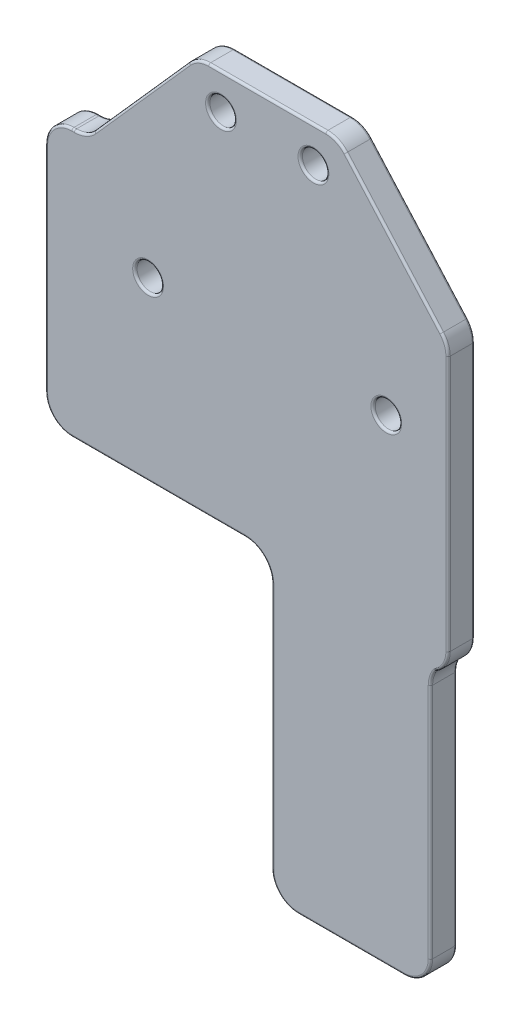
from build123d import *

# Parameters (mm, degrees)
SKETCH1_R           = 1.5
BOSS_EXTRUDE1_DEPTH = 3
FILLET1_R           = 3
FILLET2_R           = 0.25


with BuildPart() as part:
    # Sketch1 → Boss-Extrude1 (new body)
    with BuildSketch(Plane.XY):
        Polygon((-20.5, 47.899715907), (-7.989824602, 62), (7.989824602, 62), (20.5, 47.899715907), (20.5, 15.219549054), (19.070234775, 15.219549054), (18.5, 14.713620449), (18.5, -16.400284093), (0.5, -16.400284093), (0.5, 17.599715907), (-20.5, 17.599715907), (-25.136576575, 17.599715907), (-25.136576575, 47.899715907), align=None)
        with Locations((-5.239824602, 58)):
            Circle(SKETCH1_R, mode=Mode.SUBTRACT)
        with Locations((-13.5, 37.599715907)):
            Circle(SKETCH1_R, mode=Mode.SUBTRACT)
        with Locations(Location((13.5, 37.599715907, 0), (0, 0, 180))):
            Circle(SKETCH1_R, mode=Mode.SUBTRACT)
        with Locations(Location((5.239824602, 58, 0), (0, 0, 180))):
            Circle(SKETCH1_R, mode=Mode.SUBTRACT)
    extrude(amount=BOSS_EXTRUDE1_DEPTH)

    # Fillet1
    # the kernel refuses this fillet: 3 mm, written as the material it adds along each edge
    with BuildSketch(Plane(origin=(0.5, 17.599715907, 0), x_dir=(-1, 0, 0), z_dir=(0, 0, 1))) as fillet1_piece_1:
        with BuildLine():
            CenterArc((FILLET1_R, FILLET1_R), FILLET1_R, 180, 90)
            Line((0, FILLET1_R), (-FILLET1_R * 0.02, FILLET1_R))
            Line((-FILLET1_R * 0.02, FILLET1_R), (-FILLET1_R * 0.02, -FILLET1_R * 0.02))
            Line((-FILLET1_R * 0.02, -FILLET1_R * 0.02), (FILLET1_R, -FILLET1_R * 0.02))
            Line((FILLET1_R, -FILLET1_R * 0.02), (FILLET1_R, 0))
        make_face()
    extrude(amount=3)
    with BuildSketch(Plane(origin=(-20.5, 47.899715907, 0), x_dir=(0.6636697823920836, 0.7480256813369742, 0), z_dir=(0, 0, 1))) as fillet1_piece_2:
        with BuildLine():
            CenterArc((FILLET1_R * 0.449623891264, FILLET1_R), FILLET1_R, 221.580355478, 48.419644522)
            Line((-FILLET1_R * 0.298401790073, FILLET1_R * 0.336330217608), (-FILLET1_R * 0.3133623037, FILLET1_R * 0.32305682196))
            Line((-FILLET1_R * 0.3133623037, FILLET1_R * 0.32305682196), (-FILLET1_R * 0.00899247782528, -FILLET1_R * 0.02))
            Line((-FILLET1_R * 0.00899247782528, -FILLET1_R * 0.02), (FILLET1_R * 0.449623891264, -FILLET1_R * 0.02))
            Line((FILLET1_R * 0.449623891264, -FILLET1_R * 0.02), (FILLET1_R * 0.449623891264, 0))
        make_face()
    extrude(amount=3)
    with BuildSketch(Plane(origin=(18.5, 14.713620449, 0), x_dir=(0, -1, 0), z_dir=(0, 0, 1))) as fillet1_piece_3:
        with BuildLine():
            CenterArc((1.25368526, 3), FILLET1_R, 234.088286061, 35.911713939)
            Line((-0.505928605, 0.570234775), (-0.541120882, 0.521639471))
            ThreePointArc((-0.541120882, 0.521639471), (-0.297845843, 0.245297201), (-0.044881541, -0.039820187))
            Line((-0.044881541, -0.039820187), (0, -0.06))
            Line((0, -0.06), (1.25368526, -0.06))
            Line((1.25368526, -0.06), (1.25368526, 0))
        make_face()
    extrude(amount=3)
    # the kernel refuses this fillet: 3 mm, written as the material it takes off along each edge
    with BuildSketch(Plane(origin=(-7.989824602, 62, -3.372179184), x_dir=(1, 0, 0), z_dir=(0, 0, 1)), Plane(origin=(7.989824602, 62, -3.372179184), x_dir=(0.6636697823920855, -0.7480256813369726, 0), z_dir=(0, 0, 1))) as fillet1_2_piece_1:
        with BuildLine():
            CenterArc((FILLET1_R * 0.449623891264, -FILLET1_R), FILLET1_R, 90, 48.419644522)
            Line((-FILLET1_R * 0.298401790073, -FILLET1_R * 0.336330217608), (-FILLET1_R * 0.3133623037, -FILLET1_R * 0.32305682196))
            Line((-FILLET1_R * 0.3133623037, -FILLET1_R * 0.32305682196), (-FILLET1_R * 0.00899247782527, FILLET1_R * 0.02))
            Line((-FILLET1_R * 0.00899247782527, FILLET1_R * 0.02), (FILLET1_R * 0.449623891264, FILLET1_R * 0.02))
            Line((FILLET1_R * 0.449623891264, FILLET1_R * 0.02), (FILLET1_R * 0.449623891264, 0))
        make_face()
    extrude(amount=9.744358369, mode=Mode.SUBTRACT)
    with BuildSketch(Plane(origin=(18.5, -16.400284093, -7.5), x_dir=(-1, 0, 0), z_dir=(0, 0, 1)), Plane(origin=(0.5, -16.400284093, -7.5), x_dir=(0, 1, 0), z_dir=(0, 0, 1)), Plane(origin=(-25.136576575, 17.599715907, -7.5), x_dir=(0, 1, 0), z_dir=(0, 0, 1)), Plane(origin=(-25.136576575, 47.899715907, -7.5), x_dir=(1, 0, 0), z_dir=(0, 0, 1))) as fillet1_2_piece_2:
        with BuildLine():
            CenterArc((FILLET1_R, -FILLET1_R), FILLET1_R, 90, 90)
            Line((0, -FILLET1_R), (-FILLET1_R * 0.02, -FILLET1_R))
            Line((-FILLET1_R * 0.02, -FILLET1_R), (-FILLET1_R * 0.02, FILLET1_R * 0.02))
            Line((-FILLET1_R * 0.02, FILLET1_R * 0.02), (FILLET1_R, FILLET1_R * 0.02))
            Line((FILLET1_R, FILLET1_R * 0.02), (FILLET1_R, 0))
        make_face()
    extrude(amount=18, mode=Mode.SUBTRACT)
    with BuildSketch(Plane(origin=(20.5, 47.899715907, -2.847511579), x_dir=(0, -1, 0), z_dir=(0, 0, 1))) as fillet1_2_piece_3:
        with BuildLine():
            CenterArc((FILLET1_R * 0.379668210529, -FILLET1_R), FILLET1_R, 90, 41.580355478)
            Line((-FILLET1_R * 0.284001571863, -FILLET1_R * 0.251974318663), (-FILLET1_R * 0.297274967511, -FILLET1_R * 0.237013805036))
            Line((-FILLET1_R * 0.297274967511, -FILLET1_R * 0.237013805036), (-FILLET1_R * 0.00759336421058, FILLET1_R * 0.02))
            Line((-FILLET1_R * 0.00759336421058, FILLET1_R * 0.02), (FILLET1_R * 0.379668210529, FILLET1_R * 0.02))
            Line((FILLET1_R * 0.379668210529, FILLET1_R * 0.02), (FILLET1_R * 0.379668210529, 0))
        make_face()
    extrude(amount=8.695023158, mode=Mode.SUBTRACT)
    with BuildSketch(Plane(origin=(20.5, 15.219549054, -6.390599908), x_dir=(-1, 0, 0), z_dir=(0, 0, 1))) as fillet1_2_piece_4:
        with BuildLine():
            CenterArc((3, -2.556239963), FILLET1_R, 121.561373817, 58.438626183)
            Line((0, -2.556239963), (-0.06, -2.556239963))
            Line((-0.06, -2.556239963), (-0.06, 0))
            Line((-0.06, 0), (0, 0.06))
            ThreePointArc((0, 0.06), (0.714882612, 0.06), (1.398360529, 0.051124799))
            Line((1.398360529, 0.051124799), (1.429765225, 0))
        make_face()
    extrude(amount=15.781199817, mode=Mode.SUBTRACT)

    # Fillet2
    fillet2_edges = [part.edges().sort_by_distance(p)[0] for p in [
        (-6.739824602, 58, 0),
        (-6.739824602, 58, 3),
        (-15, 37.599715907, 0),
        (-15, 37.599715907, 3),
        (15, 37.599715907, 0),
        (15, 37.599715907, 3),
        (6.739824602, 58, 0),
        (6.739824602, 58, 3),
        (0, 62, 0),
        (0, 62, 3),
        (18.5, 0.029825548, 0),
        (9.5, -16.400284093, 0),
        (0.5, 0.599715907, 0),
        (-12.318288288, 17.599715907, 0),
        (-25.136576575, 32.749715907, 0),
        (-21.992724125, 47.899715907, 0),
        (-14.244912301, 54.949857953, 0),
        (14.314553508, 54.871364985, 0),
        (20.5, 32.268250146, 0),
        (-7.871191108, 61.736149488, 0),
        (-24.257896919, 47.02103625, 0),
        (-24.257896919, 18.478395563, 0),
        (1.378679656, -15.521604437, 0),
        (17.621320344, -15.521604437, 0),
        (20.118272744, 16.311327397, 0),
        (20.304659617, 47.825551373, 0),
        (7.871191108, 61.736149488, 0),
        (14.314553508, 54.871364985, 3),
        (18.5, 0.029825548, 3),
        (20.5, 32.268250146, 3),
        (-14.244912301, 54.949857953, 3),
        (-21.992724125, 47.899715907, 3),
        (-25.136576575, 32.749715907, 3),
        (-12.318288288, 17.599715907, 3),
        (0.5, 0.599715907, 3),
        (9.5, -16.400284093, 3),
        (-7.871191108, 61.736149488, 3),
        (-24.257896919, 47.02103625, 3),
        (-24.257896919, 18.478395563, 3),
        (1.378679656, -15.521604437, 3),
        (17.621320344, -15.521604437, 3),
        (20.118272744, 16.311327397, 3),
        (20.304659617, 47.825551373, 3),
        (7.871191108, 61.736149488, 3),
        (18.64611706, 14.384787698, 0),
        (18.64611706, 14.384787698, 3),
        (-0.378679656, 16.72103625, 0),
        (-0.378679656, 16.72103625, 3),
        (-20.618633494, 48.163566419, 0),
        (-20.618633494, 48.163566419, 3),
    ]]
    fillet(fillet2_edges, radius=FILLET2_R)


solid = part.part
